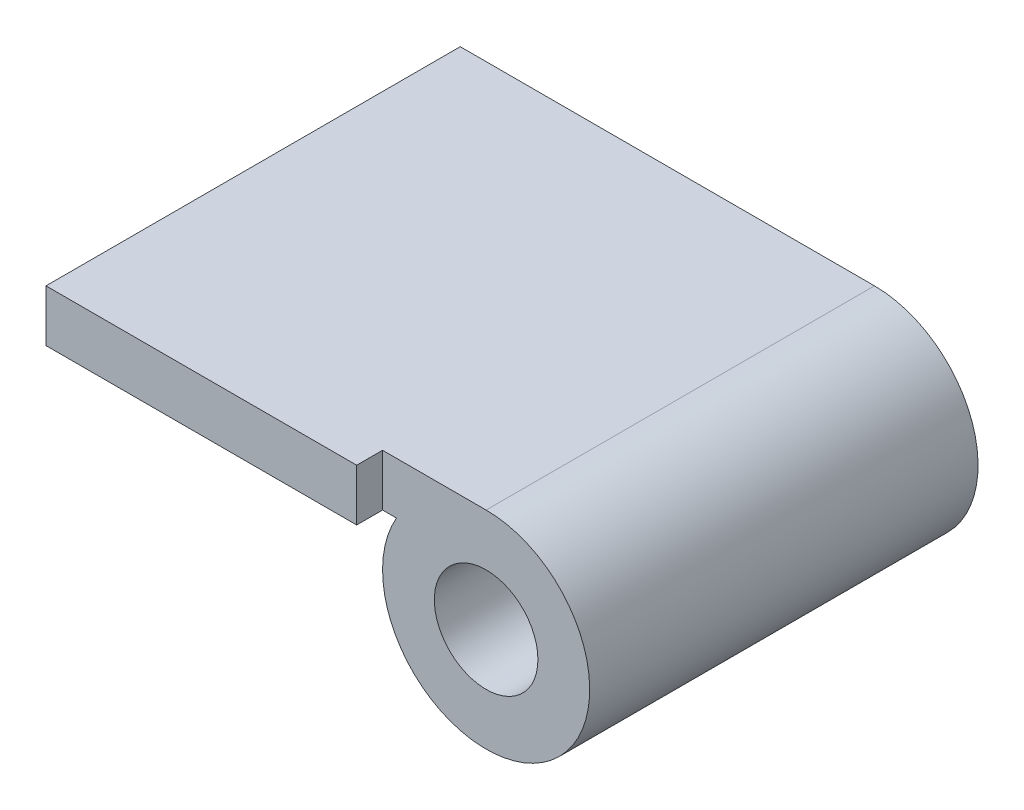
from build123d import *

# Parameters (mm, degrees)
SKETCH1_R           = 3.175
BOSS_EXTRUDE1_DEPTH = 25.4
SKETCH2_W           = 12.7
SKETCH2_H           = 12.7
CUT_EXTRUDE1_DEPTH  = 1.5875


with BuildPart() as part:
    # Sketch1 → Boss-Extrude1 (new body)
    with BuildSketch(Plane.XY):
        with BuildLine():
            Line((0, 6.35), (-25.4, 6.35))
            Line((-25.4, 6.35), (-25.4, 3.175))
            Line((-25.4, 3.175), (-5.499261314, 3.175))
            ThreePointArc((-5.499261314, 3.175), (3.175, -5.499261314), (0, 6.35))
        make_face()
        Circle(SKETCH1_R, mode=Mode.SUBTRACT)
    extrude(amount=BOSS_EXTRUDE1_DEPTH)

    # Sketch2 → Cut-Extrude1 (cut)
    with BuildSketch(Plane.XY.offset(25.4)):
        Rectangle(SKETCH2_W, SKETCH2_H)
    extrude(amount=-CUT_EXTRUDE1_DEPTH, mode=Mode.SUBTRACT)


solid = part.part
